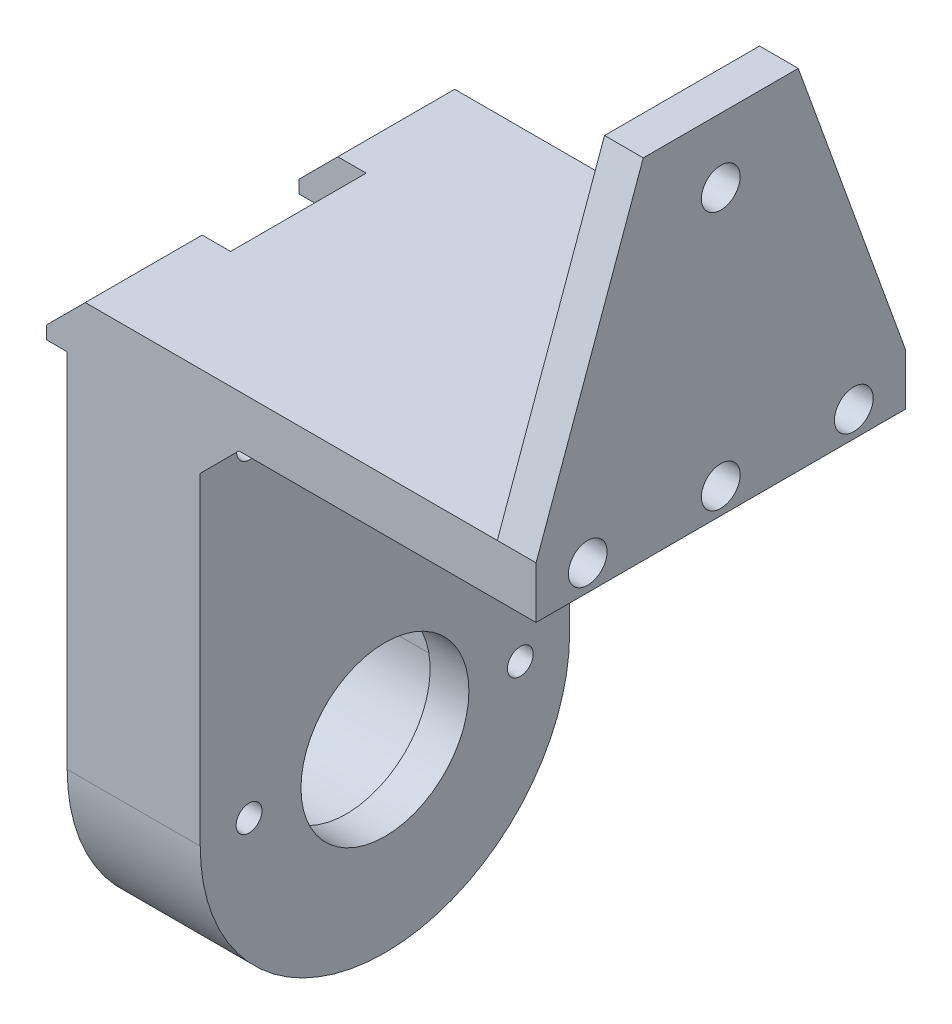
from build123d import *

# Parameters (mm, degrees)
EXTRUDE_1_DEPTH          = 28.6
SKETCH_2_R               = 1
CUT_EXTRUDE_1_DEPTH      = 28.6
FILLET_1_R               = 14.3
CUT_EXTRUDE_2_DEPTH      = 7.3
CUT_EXTRUDE_4_DEPTH      = 19.6
CUT_EXTRUDE_4_DEPTH_BACK = 3.6
SKETCH_4_W               = 10.5
SKETCH_4_H               = 22.266748583
SKETCH_5_R               = 6.5
CUT_EXTRUDE_5_DEPTH      = 3.6
CUT_EXTRUDE_6_DEPTH      = 22.6
SKETCH_7_R               = 1.5
CUT_EXTRUDE_7_DEPTH      = 8


with BuildPart() as part:
    # Model → 凸台-拉伸1 (new body)
    with BuildSketch(Plane.XY):
        Polygon((-24.978787879, -17.92321671), (-14.678787879, -17.92321671), (-14.678787879, 21.376794113), (-11.678787879, 24.376794113), (11.321212121, 24.376794113), (11.321212121, 51.376794114), (8.321212121, 51.376794114), (8.321212121, 28.376794114), (-23.578787879, 28.376794114), (-26.578787879, 25.376794114), (-26.578787879, 24.376794113), (-24.978787879, 24.376794113), align=None)
    extrude(amount=EXTRUDE_1_DEPTH)

    # 草图2 → 切除-拉伸1 (cut)
    with BuildSketch(Plane.ZY.offset(24.978787879)):
        with Locations((3.78, 21.376794113)):
            Circle(SKETCH_2_R)
        with Locations((24.78, 21.376794113)):
            Circle(SKETCH_2_R)
        with Locations((24.82, -3.623205887)):
            Circle(SKETCH_2_R)
        with Locations((3.82, -3.623205887)):
            Circle(SKETCH_2_R)
    extrude(amount=-CUT_EXTRUDE_1_DEPTH, mode=Mode.SUBTRACT)

    # 圆角1
    fillet_1_edges = [part.edges().sort_by_distance(p)[0] for p in [
        (-19.828787879, -17.92321671, 28.6),
        (-19.828787879, -17.92321671, 0),
    ]]
    fillet(fillet_1_edges, radius=FILLET_1_R - 0.0001)  # a hair under: the kernel refuses the full size

    # 草图3 → 切除-拉伸2 (cut)
    with BuildSketch(Plane.ZY.offset(24.978787879)):
        with BuildLine():
            Line((21.8, -3.62321671), (21.8, 19.87678329))
            ThreePointArc((21.8, 19.87678329), (21.360660172, 20.937443461), (20.3, 21.37678329))
            Line((20.3, 21.37678329), (8.3, 21.37678329))
            ThreePointArc((8.3, 21.37678329), (7.239339828, 20.937443461), (6.8, 19.87678329))
            Line((6.8, 19.87678329), (6.8, -3.62321671))
            ThreePointArc((6.8, -3.62321671), (14.3, -11.12321671), (21.8, -3.62321671))
        make_face()
    extrude(amount=-CUT_EXTRUDE_2_DEPTH, mode=Mode.SUBTRACT)

    # 草图4 → 切除-拉伸4 (cut, two sides: drawn at the far end of the back side and taken through both)
    with BuildSketch(Plane.ZY.offset(24.978787879).offset(-CUT_EXTRUDE_4_DEPTH_BACK)):
        with Locations((14.3, 25.815793082)):
            Rectangle(SKETCH_4_W, SKETCH_4_H)
    extrude(amount=CUT_EXTRUDE_4_DEPTH + CUT_EXTRUDE_4_DEPTH_BACK, mode=Mode.SUBTRACT)

    # 草图5 → 切除-拉伸5 (cut)
    with BuildSketch(Plane.ZY.offset(17.678787879)):
        with Locations((14.3, -3.62321671)):
            Circle(SKETCH_5_R)
    extrude(amount=-CUT_EXTRUDE_5_DEPTH, mode=Mode.SUBTRACT)

    # 草图6 → 切除-拉伸6 (cut)
    with BuildSketch(Plane(origin=(11.321212121, 0, 0), x_dir=(0, 0, -1), z_dir=(1, 0, 0))):
        Polygon((0, 28.376794114), (-8.3, 51.376794114), (5.727876299, 54.90154804), align=None)
        Polygon((-20.3, 51.376794114), (-28.6, 28.376794114), (-35.26481715, 54.90154804), align=None)
    extrude(amount=-CUT_EXTRUDE_6_DEPTH, mode=Mode.SUBTRACT)

    # 草图7 → 切除-拉伸7 (cut)
    with BuildSketch(Plane(origin=(11.321212121, 0, 0), x_dir=(0, 0, -1), z_dir=(1, 0, 0))):
        with Locations((-14.3, 46.376794114)):
            Circle(SKETCH_7_R)
        with Locations((-24.6, 26.376794113)):
            Circle(SKETCH_7_R)
        with Locations((-14.3, 26.376794113)):
            Circle(SKETCH_7_R)
        with Locations((-4, 26.376794113)):
            Circle(SKETCH_7_R)
    extrude(amount=-CUT_EXTRUDE_7_DEPTH, mode=Mode.SUBTRACT)


solid = part.part
